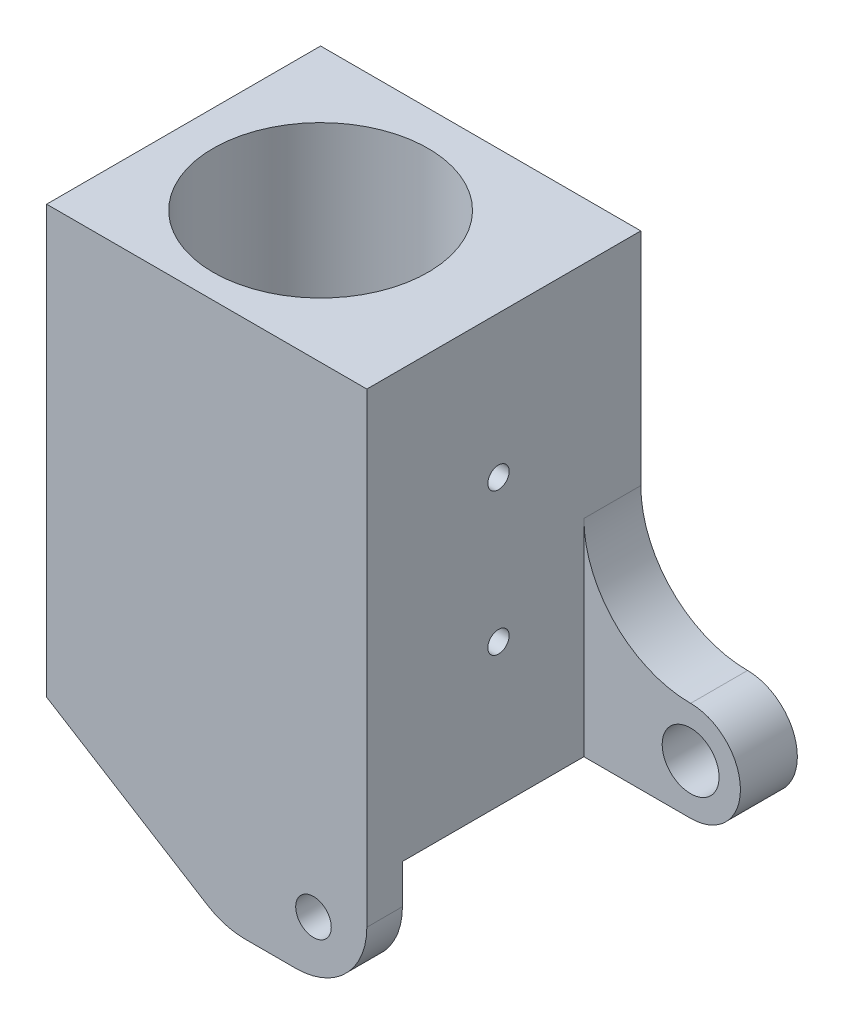
from build123d import *

# Parameters (mm, degrees)
SKETCH_1_W             = 45
SKETCH_1_H             = 38.5
EXTRUDE_1_DEPTH        = 60
SKETCH_2_R             = 15.1
CUT_EXTRUDE_1_DEPTH    = 50
SKETCH_3_R             = 2.5
EXTRUDE_2_DEPTH        = 5
SKETCH_4_R             = 1.5
CUT_EXTRUDE_2_DEPTH    = 78.620873481
PATTERN_LINEAR_1_COUNT = 2
PATTERN_LINEAR_1_PITCH = 20
FILLET_1_R             = 10
SKETCH_5_R             = 4
EXTRUDE_3_DEPTH        = 8
FILLET_2_R             = 15


with BuildPart() as part:
    # 草圖1 → 填料-伸長1 (new body)
    with BuildSketch(Plane(origin=(0, 0, 0), x_dir=(1, 0, 0), z_dir=(0, 1, 0))):
        with Locations((2.5, 0.75)):
            Rectangle(SKETCH_1_W, SKETCH_1_H)
    extrude(amount=EXTRUDE_1_DEPTH)

    # 草圖2 → 除料-伸長1 (cut)
    with BuildSketch(Plane(origin=(0, 60, 0), x_dir=(1, 0, 0), z_dir=(0, 1, 0))):
        with Locations(Location((0, 0, 0), (0, 0, 270))):
            Circle(SKETCH_2_R)
    extrude(amount=-CUT_EXTRUDE_1_DEPTH, mode=Mode.SUBTRACT)

    # 草圖3 → 填料-伸長2 (add)
    with BuildSketch(Plane.XY.offset(18.5)):
        Polygon((-20, 0), (5, -15.5), (25, -15.5), (25, 0), align=None)
        with Locations((17.5, -8)):
            Circle(SKETCH_3_R, mode=Mode.SUBTRACT)
    extrude(amount=-EXTRUDE_2_DEPTH)

    # 草圖4 → 除料-伸長2 (cut, through all)
    with BuildSketch(Plane(origin=(25, 0, 0), x_dir=(0, 0, -1), z_dir=(1, 0, 0))):
        with Locations((0, 20)):
            Circle(SKETCH_4_R)
    cut_extrude_2 = extrude(amount=-CUT_EXTRUDE_2_DEPTH, mode=Mode.SUBTRACT)

    # 直線複製排列1: 除料-伸長2 ×2
    with Locations(*[(0, i * PATTERN_LINEAR_1_PITCH, 0) for i in range(1, PATTERN_LINEAR_1_COUNT)]):
        add(cut_extrude_2, mode=Mode.SUBTRACT)

    # 圓角1
    fillet_1_edges = [part.edges().sort_by_distance(p)[0] for p in [
        (25, -15.5, 16),
        (5, -15.5, 16),
    ]]
    fillet(fillet_1_edges, radius=FILLET_1_R)

    # 草圖5 → 填料-伸長3 (add)
    with BuildSketch(Plane(origin=(0, 0, -20), x_dir=(-1, 0, 0), z_dir=(0, 0, -1))):
        with BuildLine():
            Line((-25, 0), (-40, 0))
            ThreePointArc((-40, 0), (-47, 7), (-40, 14))
            Line((-40, 14), (-25, 14))
            Line((-25, 14), (-25, 0))
        make_face()
        with Locations((-40, 7)):
            Circle(SKETCH_5_R, mode=Mode.SUBTRACT)
    extrude(amount=-EXTRUDE_3_DEPTH)

    # 圓角2
    fillet_2_edges = [part.edges().sort_by_distance(p)[0] for p in [
        (25, 14, -16),
    ]]
    fillet(fillet_2_edges, radius=FILLET_2_R - 0.0001)  # a hair under: the kernel refuses the full size


solid = part.part
